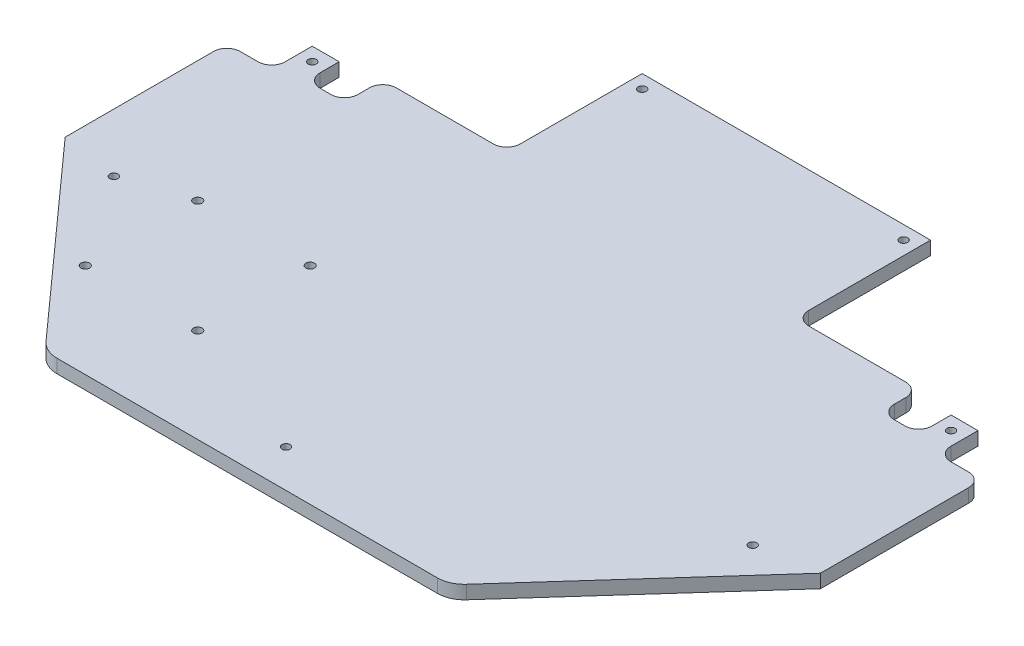
from build123d import *

# Parameters (mm, degrees)
ESQUISSE1_W              = 280.2
ESQUISSE1_H              = 276.282873123
BOSS_EXTRU_1_DEPTH       = 5
ENL_V_MAT_EXTRU_3_DEPTH  = 283.344868376
ENL_V_MAT_EXTRU_5_DEPTH  = 283.344868376
ESQUISSE8_R              = 1.5
ENL_V_MAT_EXTRU_8_DEPTH  = 283.344868376
ENL_V_MAT_EXTRU_15_DEPTH = 283.344868376
CONG_1_R                 = 10
ESQUISSE13_R             = 1.5
ENL_V_MAT_EXTRU_16_DEPTH = 220.422993326
ESQUISSE14_R             = 1.6
ENL_V_MAT_EXTRU_17_DEPTH = 220.422993326
ESQUISSE15_R             = 1.5
ENL_V_MAT_EXTRU_18_DEPTH = 220.422993326
ESQUISSE17_R             = 1.5
ENL_V_MAT_EXTRU_20_DEPTH = 220.422993326


with BuildPart() as part:
    # Esquisse1 → Boss.-Extru.1 (new body)
    with BuildSketch(Plane(origin=(0, 0, 0), x_dir=(1, 0, 0), z_dir=(0, 1, 0))):
        with Locations((0, -106.941436562)):
            Rectangle(ESQUISSE1_W, ESQUISSE1_H)
    extrude(amount=BOSS_EXTRU_1_DEPTH)

    # Esquisse4 → Enlèv. mat.-Extru.3 (cut, through all)
    with BuildSketch(Plane(origin=(0, 5, 0), x_dir=(1, 0, 0), z_dir=(0, 1, 0))):
        with BuildLine():
            Line((140.1, -245.082873123), (101.1, -245.082873123))
            ThreePointArc((101.1, -245.082873123), (128.677164466, -233.660037589), (140.1, -206.082873123))
            Line((140.1, -206.082873123), (140.1, -245.082873123))
        make_face()
        with BuildLine():
            Line((-101.1, -245.082873123), (-140.1, -245.082873123))
            Line((-140.1, -245.082873123), (-140.1, -206.082873123))
            ThreePointArc((-140.1, -206.082873123), (-128.677164466, -233.660037589), (-101.1, -245.082873123))
        make_face()
    extrude(amount=-ENL_V_MAT_EXTRU_3_DEPTH, mode=Mode.SUBTRACT)

    # Esquisse6 → Enlèv. mat.-Extru.5 (cut, through all)
    with BuildSketch(Plane(origin=(0, 5, 0), x_dir=(1, 0, 0), z_dir=(0, 1, 0))):
        with BuildLine():
            Line((140.1, 31.2), (53.5, 31.2))
            Line((53.5, 31.2), (53.5, -14))
            ThreePointArc((53.5, -14), (54.964466094, -17.535533906), (58.5, -19))
            Line((58.5, -19), (94.5, -19))
            ThreePointArc((94.5, -19), (98.035533906, -20.464466094), (99.5, -24))
            Line((99.5, -24), (99.5, -28.25))
            ThreePointArc((99.5, -28.25), (100.964466094, -31.785533906), (104.5, -33.25))
            Line((104.5, -33.25), (108.5, -33.25))
            ThreePointArc((108.5, -33.25), (112.035533906, -31.785533906), (113.5, -28.25))
            Line((113.5, -28.25), (113.5, -21.2))
            Line((113.5, -21.2), (123.5, -21.2))
            Line((123.5, -21.2), (123.5, -31.25))
            ThreePointArc((123.5, -31.25), (124.964466094, -34.785533906), (128.5, -36.25))
            Line((128.5, -36.25), (135.1, -36.25))
            ThreePointArc((135.1, -36.25), (138.635533906, -37.714466094), (140.1, -41.25))
            Line((140.1, -41.25), (140.1, 31.2))
        make_face()
        with BuildLine():
            Line((-53.5, -14), (-53.5, 31.2))
            Line((-53.5, 31.2), (-140.1, 31.2))
            Line((-140.1, 31.2), (-140.1, -41.25))
            ThreePointArc((-140.1, -41.25), (-138.635533906, -37.714466094), (-135.1, -36.25))
            Line((-135.1, -36.25), (-128.5, -36.25))
            ThreePointArc((-128.5, -36.25), (-124.964466094, -34.785533906), (-123.5, -31.25))
            Line((-123.5, -31.25), (-123.5, -21.2))
            Line((-123.5, -21.2), (-113.5, -21.2))
            Line((-113.5, -21.2), (-113.5, -28.25))
            ThreePointArc((-113.5, -28.25), (-112.035533906, -31.785533906), (-108.5, -33.25))
            Line((-108.5, -33.25), (-104.5, -33.25))
            ThreePointArc((-104.5, -33.25), (-100.964466094, -31.785533906), (-99.5, -28.25))
            Line((-99.5, -28.25), (-99.5, -24))
            ThreePointArc((-99.5, -24), (-98.035533906, -20.464466094), (-94.5, -19))
            Line((-94.5, -19), (-58.5, -19))
            ThreePointArc((-58.5, -19), (-54.964466094, -17.535533906), (-53.5, -14))
        make_face()
    extrude(amount=-ENL_V_MAT_EXTRU_5_DEPTH, mode=Mode.SUBTRACT)

    # Esquisse8 → Enlèv. mat.-Extru.8 (cut, through all)
    with BuildSketch(Plane.XZ):
        with Locations((-48.5, -26.2)):
            Circle(ESQUISSE8_R)
        with Locations((48.5, -26.2)):
            Circle(ESQUISSE8_R)
    extrude(amount=-ENL_V_MAT_EXTRU_8_DEPTH, mode=Mode.SUBTRACT)

    # Esquisse12 → Enlèv. mat.-Extru.15 (cut, through all)
    with BuildSketch(Plane(origin=(0, 5, 0), x_dir=(1, 0, 0), z_dir=(0, 1, 0))):
        Polygon((-140.1, -96.25), (-75, -168.8), (75, -168.8), (140.1, -96.25), (146.03275504, -294.983631094), (-140.1, -294.983631094), align=None)
    extrude(amount=-ENL_V_MAT_EXTRU_15_DEPTH, mode=Mode.SUBTRACT)

    # Congé1
    cong_1_edges = [part.edges().sort_by_distance(p)[0] for p in [
        (-75, 2.5, 168.8),
        (75, 2.5, 168.8),
    ]]
    fillet(cong_1_edges, radius=CONG_1_R)

    # Esquisse13 → Enlèv. mat.-Extru.16 (cut, through all)
    with BuildSketch(Plane(origin=(0, 5, 0), x_dir=(1, 0, 0), z_dir=(0, 1, 0))):
        with Locations((0.38736006, -154.8)):
            Circle(ESQUISSE13_R)
    extrude(amount=-ENL_V_MAT_EXTRU_16_DEPTH, mode=Mode.SUBTRACT)

    # Esquisse14 → Enlèv. mat.-Extru.17 (cut, through all)
    with BuildSketch(Plane(origin=(0, 5, 0), x_dir=(1, 0, 0), z_dir=(0, 1, 0))):
        with Locations((-95.1, -133.8)):
            Circle(ESQUISSE14_R)
        with Locations((-53.38, -133.8)):
            Circle(ESQUISSE14_R)
        with Locations((-95.1, -92.08)):
            Circle(ESQUISSE14_R)
        with Locations((-53.38, -92.08)):
            Circle(ESQUISSE14_R)
    extrude(amount=-ENL_V_MAT_EXTRU_17_DEPTH, mode=Mode.SUBTRACT)

    # Esquisse15 → Enlèv. mat.-Extru.18 (cut, through all)
    with BuildSketch(Plane(origin=(0, 5, 0), x_dir=(1, 0, 0), z_dir=(0, 1, 0))):
        with Locations((-118.5, -26.2)):
            Circle(ESQUISSE15_R)
        with Locations((118.5, -26.2)):
            Circle(ESQUISSE15_R)
    extrude(amount=-ENL_V_MAT_EXTRU_18_DEPTH, mode=Mode.SUBTRACT)

    # Esquisse17 → Enlèv. mat.-Extru.20 (cut, through all)
    with BuildSketch(Plane(origin=(0, 5, 0), x_dir=(1, 0, 0), z_dir=(0, 1, 0))):
        with Locations((-118.5, -99.8)):
            Circle(ESQUISSE17_R)
        with Locations((118.5, -99.8)):
            Circle(ESQUISSE17_R)
    extrude(amount=-ENL_V_MAT_EXTRU_20_DEPTH, mode=Mode.SUBTRACT)


solid = part.part
